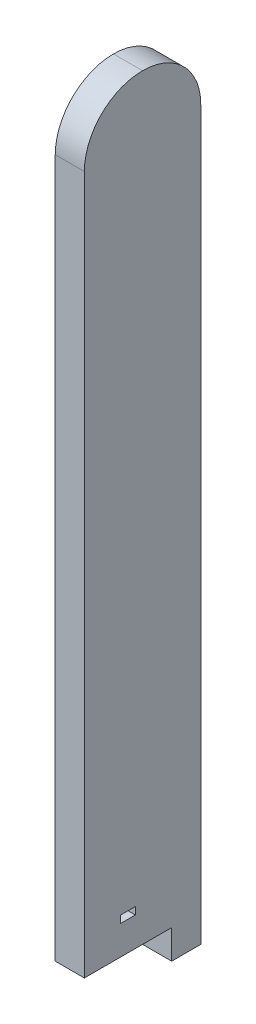
from build123d import *

# Parameters (mm, degrees)
BOSS_EXTRUDE1_DEPTH  = 3.175
FILLET1_R            = 12.7
SKETCH2_W            = 3.175
SKETCH2_H            = 1.5875
CABLE_TIE_HOLE_DEPTH = 160.383735055


with BuildPart() as part:
    # Sketch1 → Boss-Extrude1 (new, symmetric)
    with BuildSketch(Plane(origin=(0, 0, 0), x_dir=(0, 0, -1), z_dir=(1, 0, 0))):
        Polygon((12.7, -69.53755182), (12.7, -158.75), (6.35, -158.75), (6.35, -152.4), (-12.7, -152.4), (-12.7, 12.7), (12.7, 12.7), align=None)
    extrude(amount=BOSS_EXTRUDE1_DEPTH, both=True)

    # Fillet1
    fillet1_edges = [part.edges().sort_by_distance(p)[0] for p in [
        (0, 12.7, -12.7),
        (0, 12.7, 12.7),
    ]]
    fillet(fillet1_edges, radius=FILLET1_R - 0.0001)  # a hair under: the kernel refuses the full size

    # Sketch2 → Cable-tie hole (cut, through all)
    with BuildSketch(Plane(origin=(3.175, 0, 0), x_dir=(0, 0, -1), z_dir=(1, 0, 0))):
        with Locations((-3.175, -145.25625)):
            Rectangle(SKETCH2_W, SKETCH2_H)
    extrude(amount=-CABLE_TIE_HOLE_DEPTH, mode=Mode.SUBTRACT)


solid = part.part
